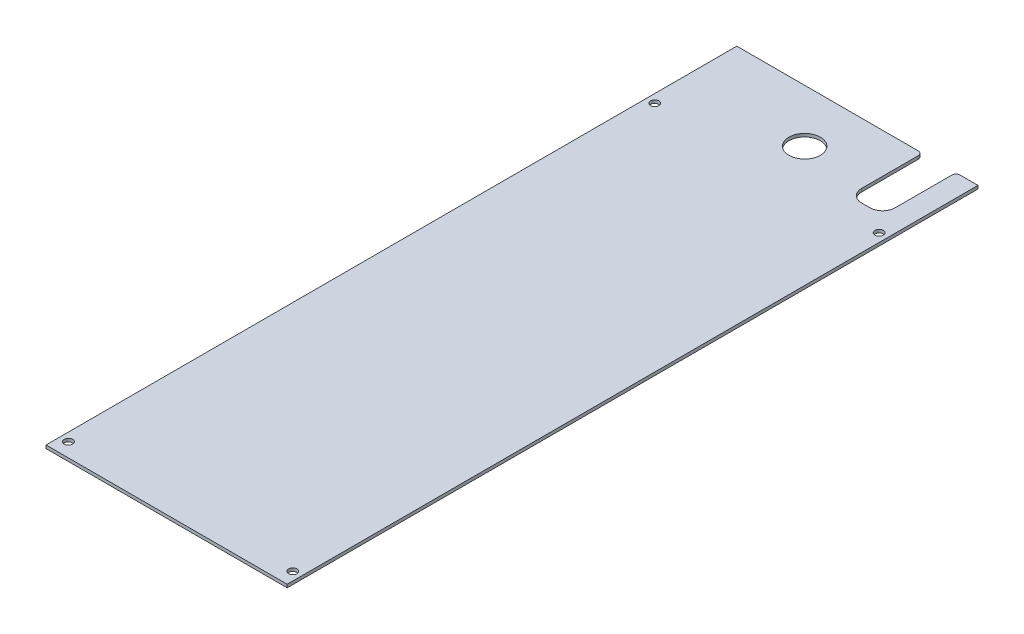
from build123d import *

# Parameters (mm, degrees)
CROQUIS12_W           = 115
CROQUIS12_H           = 329.4
BRIDA_BASE2_DEPTH     = 1.5
CORTAR_EXTRUIR6_REACH = 217.797
CROQUIS27_R           = 2
CORTAR_EXTRUIR7_REACH = 217.797
CROQUIS28_R           = 7.5
CROQUIS29_W           = 16
CROQUIS29_H           = 35
CORTAR_EXTRUIR8_DEPTH = 216.796988162
REDONDEO1_R           = 6
REDONDEO2_R           = 2


# Sheet-metal steps are written as plain solids
with BuildPart() as part:
    # Croquis12 → Brida base2 (new body)
    with BuildSketch(Plane(origin=(0, 0, 0), x_dir=(1, 0, 0), z_dir=(0, 1, 0))):
        with Locations((0, -43.29)):
            Rectangle(CROQUIS12_W, CROQUIS12_H)
    extrude(amount=-BRIDA_BASE2_DEPTH)

    # Croquis27 → Cortar-Extruir6 (cut, up to next)
    with BuildSketch(Plane(origin=(0, 0, 0), x_dir=(1, 0, 0), z_dir=(0, 1, 0)), mode=Mode.PRIVATE) as cortar_extruir6_sk1:
        with Locations(Location((-53.5, -201.3, 0), (0, 0, 270))):
            Circle(CROQUIS27_R)
    cortar_extruir6_tool1 = extrude(cortar_extruir6_sk1.sketch, amount=-CORTAR_EXTRUIR6_REACH, mode=Mode.PRIVATE) & part.part
    # Croquis27 → Cortar-Extruir6 (cut, up to next)
    with BuildSketch(Plane(origin=(0, 0, 0), x_dir=(1, 0, 0), z_dir=(0, 1, 0)), mode=Mode.PRIVATE) as cortar_extruir6_sk2:
        with Locations(Location((-53.5, 78.26, 0), (0, 0, 270))):
            Circle(CROQUIS27_R)
    cortar_extruir6_tool2 = extrude(cortar_extruir6_sk2.sketch, amount=-CORTAR_EXTRUIR6_REACH, mode=Mode.PRIVATE) & part.part
    # Croquis27 → Cortar-Extruir6 (cut, up to next)
    with BuildSketch(Plane(origin=(0, 0, 0), x_dir=(1, 0, 0), z_dir=(0, 1, 0)), mode=Mode.PRIVATE) as cortar_extruir6_sk3:
        with Locations(Location((53.5, 78.26, 0), (0, 0, 90))):
            Circle(CROQUIS27_R)
    cortar_extruir6_tool3 = extrude(cortar_extruir6_sk3.sketch, amount=-CORTAR_EXTRUIR6_REACH, mode=Mode.PRIVATE) & part.part
    # Croquis27 → Cortar-Extruir6 (cut, up to next)
    with BuildSketch(Plane(origin=(0, 0, 0), x_dir=(1, 0, 0), z_dir=(0, 1, 0)), mode=Mode.PRIVATE) as cortar_extruir6_sk4:
        with Locations(Location((53.5, -201.3, 0), (0, 0, 90))):
            Circle(CROQUIS27_R)
    cortar_extruir6_tool4 = extrude(cortar_extruir6_sk4.sketch, amount=-CORTAR_EXTRUIR6_REACH, mode=Mode.PRIVATE) & part.part
    add(cortar_extruir6_tool1.solids().sort_by_distance((-53.5, 0, 201.3))[0], mode=Mode.SUBTRACT)
    add(cortar_extruir6_tool2.solids().sort_by_distance((-53.5, 0, -78.26))[0], mode=Mode.SUBTRACT)
    add(cortar_extruir6_tool3.solids().sort_by_distance((53.5, 0, -78.26))[0], mode=Mode.SUBTRACT)
    add(cortar_extruir6_tool4.solids().sort_by_distance((53.5, 0, 201.3))[0], mode=Mode.SUBTRACT)

    # Croquis28 → Cortar-Extruir7 (cut, up to next)
    with BuildSketch(Plane(origin=(0, 0, 0), x_dir=(1, 0, 0), z_dir=(0, 1, 0)), mode=Mode.PRIVATE) as cortar_extruir7_sk1:
        with Locations(Location((0, 96.25, 0), (0, 0, 270))):
            Circle(CROQUIS28_R)
    cortar_extruir7_tool1 = extrude(cortar_extruir7_sk1.sketch, amount=-CORTAR_EXTRUIR7_REACH, mode=Mode.PRIVATE) & part.part
    add(cortar_extruir7_tool1.solids().sort_by_distance((0, 0, -96.25))[0], mode=Mode.SUBTRACT)

    # Croquis29 → Cortar-Extruir8 (cut, through all)
    with BuildSketch(Plane(origin=(0, 0, 0), x_dir=(1, 0, 0), z_dir=(0, 1, 0))):
        with Locations((39, 103.91)):
            Rectangle(CROQUIS29_W, CROQUIS29_H)
    extrude(amount=-CORTAR_EXTRUIR8_DEPTH, mode=Mode.SUBTRACT)

    # Redondeo1
    redondeo1_edges = [part.edges().sort_by_distance(p)[0] for p in [
        (31, -0.75, -86.41),
        (47, -0.75, -86.41),
    ]]
    fillet(redondeo1_edges, radius=REDONDEO1_R)

    # Redondeo2
    redondeo2_edges = [part.edges().sort_by_distance(p)[0] for p in [
        (31, -0.75, -121.41),
        (47, -0.75, -121.41),
    ]]
    fillet(redondeo2_edges, radius=REDONDEO2_R)


solid = part.part
